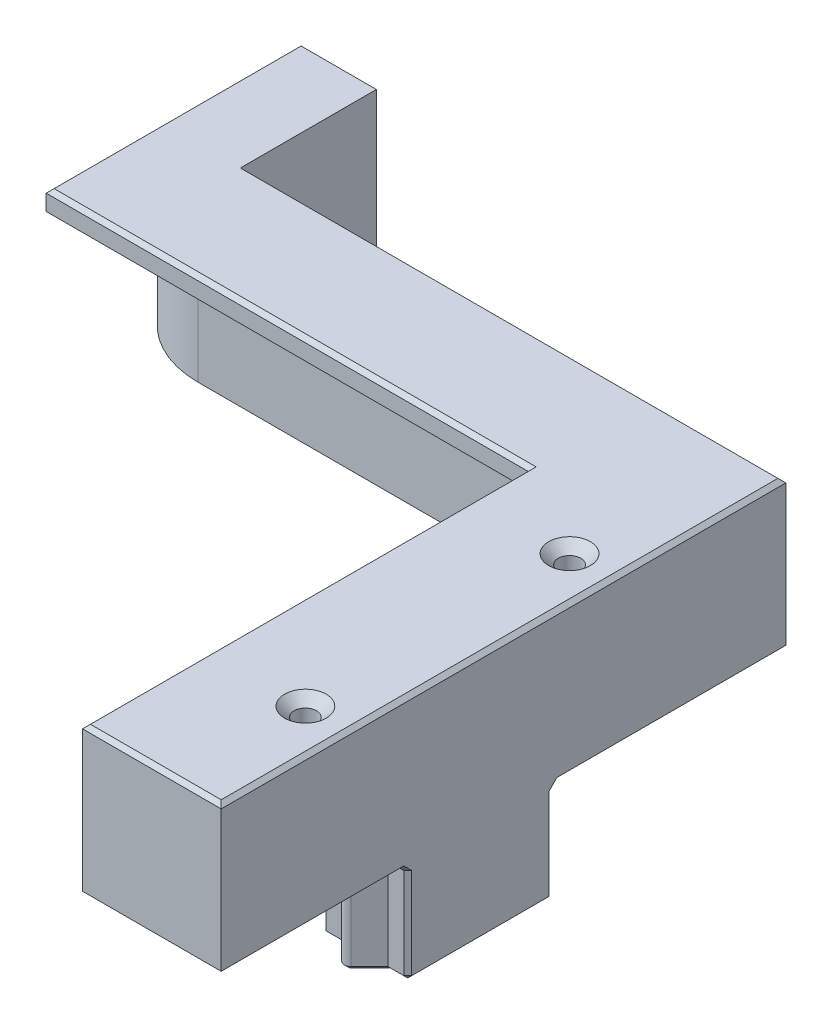
from build123d import *
from OCP.BRepFilletAPI import BRepFilletAPI_MakeFillet

# Parameters (mm, degrees)
BOSS_EXTRUDE1_DEPTH                                 = 15
BOSS_EXTRUDE2_DEPTH                                 = 22.5
SKETCH3_W                                           = 8
SKETCH3_H                                           = 3
BOSS_EXTRUDE3_DEPTH                                 = 3
SKETCH8_W                                           = 12
SKETCH8_H                                           = 25
CUT_EXTRUDE1_DEPTH                                  = 2
CSK_FOR_M3_COUNTERSUNK_FLAT_HEAD_SCREW1_D           = 3.4
CSK_FOR_M3_COUNTERSUNK_FLAT_HEAD_SCREW1_CSINK_D     = 6.3
CSK_FOR_M3_COUNTERSUNK_FLAT_HEAD_SCREW1_CSINK_ANGLE = 90
SKETCH9_W                                           = 12
SKETCH9_H                                           = 22.5
BOSS_EXTRUDE4_DEPTH                                 = 20
FILLET1_R                                           = 15
FILLET2_R1                                          = 1
FILLET2_R2                                          = 2
CHAMFER1_SIZE                                       = 0.6
CHAMFER2_SIZE                                       = 2


with BuildPart() as part:
    # Sketch1 → Boss-Extrude1 (new body)
    with BuildSketch(Plane(origin=(0, 0, 0), x_dir=(1, 0, 0), z_dir=(0, 1, 0))):
        Polygon((6.5, 14.5), (3, 11), (0, 11), (0, -11), (3, -11), (6.5, -14.5), (10, -11), (13, -11), (13, 11), (10, 11), align=None)
    extrude(amount=-BOSS_EXTRUDE1_DEPTH)

    # Sketch2 → Boss-Extrude2 (add)
    with BuildSketch(Plane(origin=(0, 0, 0), x_dir=(1, 0, 0), z_dir=(0, 1, 0))):
        Polygon((0, -39.25), (13, -39.25), (13, -11), (10, -11), (6.5, -14.5), (3, -11), (0, -11), align=None)
        Polygon((10, 11), (13, 11), (13, 46.25), (-81, 46.25), (-81, 36.25), (0, 36.25), (0, 11), (3, 11), (6.5, 14.5), align=None)
        Polygon((3, 11), (0, 11), (0, -11), (3, -11), (6.5, -14.5), (10, -11), (13, -11), (13, 11), (10, 11), (6.5, 14.5), align=None)
    extrude(amount=BOSS_EXTRUDE2_DEPTH)

    # Sweep1: sweep along a curve in space
    with BuildLine() as sweep1_path:
        Line((0, 22.5, 39.25), (0, 0, 39.25))
    # Sketch3 → Sweep1 (sweep)
    with BuildSketch(Plane(origin=(0, 22.5, 0), x_dir=(1, 0, 0), z_dir=(0, 1, 0))):
        with Locations((-4, -37.75)):
            Rectangle(SKETCH3_W, SKETCH3_H)
    sweep(path=sweep1_path.line)

    # Sketch4 → Boss-Extrude3 (add)
    with BuildSketch(Plane(origin=(0, 22.5, 0), x_dir=(1, 0, 0), z_dir=(0, 1, 0))):
        Polygon((-8, -36.25), (0, -36.25), (0, 36.25), (-81, 36.25), (-81, 28.25), (-8, 28.25), align=None)
    extrude(amount=-BOSS_EXTRUDE3_DEPTH)

    # Sketch8 → Cut-Extrude1 (cut)
    with BuildSketch(Plane.ZY):
        with Locations((0, 7)):
            Rectangle(SKETCH8_W, SKETCH8_H)
    extrude(amount=-CUT_EXTRUDE1_DEPTH, mode=Mode.SUBTRACT)

    # CSK for M3 Countersunk Flat Head Screw1 (through all)
    with Locations(Plane(origin=(0, 22.5, 0), x_dir=(1, 0, 0), z_dir=(0, 1, 0))):
        with Locations((6.5, 20), (6.5, -20)):
            CounterSinkHole(CSK_FOR_M3_COUNTERSUNK_FLAT_HEAD_SCREW1_D / 2, CSK_FOR_M3_COUNTERSUNK_FLAT_HEAD_SCREW1_CSINK_D / 2, counter_sink_angle=CSK_FOR_M3_COUNTERSUNK_FLAT_HEAD_SCREW1_CSINK_ANGLE)

    # Sketch9 → Boss-Extrude4 (add)
    with BuildSketch(Plane(origin=(0, 0, -46.25), x_dir=(-1, 0, 0), z_dir=(0, 0, -1))):
        with Locations((75, 11.25)):
            Rectangle(SKETCH9_W, SKETCH9_H)
    extrude(amount=BOSS_EXTRUDE4_DEPTH)

    # Fillet1
    fillet1_edges = [part.edges().sort_by_distance(p)[0] for p in [
        (-81, 9.75, -36.25),
    ]]
    fillet(fillet1_edges, radius=FILLET1_R)

    # Fillet2: one fillet with a radius per group of edges: ONE call of the kernel's fillet builder (fillet() takes one radius for all edges)
    fillet2_edges_1 = [part.edges().sort_by_distance(p)[0] for p in [
        (6.5, -7.5, -14.5),
        (6.5, -7.5, 14.5),
    ]]
    fillet2_edges_2 = [part.edges().sort_by_distance(p)[0] for p in [
        (0, 9.75, -36.25),
    ]]
    fillet2 = BRepFilletAPI_MakeFillet(part.part.solid().wrapped)
    for e in fillet2_edges_1:
        fillet2.Add(FILLET2_R1, e.wrapped)
    for e in fillet2_edges_2:
        fillet2.Add(FILLET2_R2, e.wrapped)
    add(Compound.cast(fillet2.Shape()), mode=Mode.REPLACE)

    # Chamfer1
    chamfer1_edges = [part.edges().sort_by_distance(p)[0] for p in [
        (1.5, 0, -11),
        (8.2, 0, -20),
        (8.603553391, 0, -12.396446609),
        (8.2, 0, 20),
        (11.5, 0, -11),
        (-69, 0, -56.25),
        (-75, 0, -66.25),
        (11.5, 0, 11),
        (4.396446609, -15, 12.396446609),
        (4.396446609, 0, 12.396446609),
        (-76.606601718, 0, -40.643398282),
        (1.5, 0, 11),
        (-34, 0, -36.25),
        (4.396446609, 0, -12.396446609),
        (4.396446609, -15, -12.396446609),
        (8.603553391, -15, 12.396446609),
        (6.5, -15, 14.085786438),
        (6.5, -15, -14.085786438),
        (8.603553391, 0, 12.396446609),
        (-0.585786438, 0, -35.664213562),
        (6.5, 0, -14.085786438),
        (6.5, 0, 14.085786438),
        (0, -7.5, -11),
        (13, -7.5, -11),
        (13, -7.5, 11),
        (0, -7.5, 11),
        (11.5, -15, 11),
        (13, -15, 0),
        (11.5, -15, -11),
        (2.5, 0, 39.25),
        (8.603553391, -15, -12.396446609),
        (0, 0, -22.625),
        (2.5, 22.5, 39.25),
        (13, 0, 25.125),
        (13, 0, -28.625),
        (-28, 0, -46.25),
        (-81, 0, -58.75),
        (13, 22.5, -3.5),
        (-28, 22.5, -46.25),
        (-81, 22.5, -47.25),
        (1.5, -15, -11),
        (0, -15, 0),
        (0, 0, 23.625),
        (-8, 22.5, 5.5),
        (-4, 0, 36.25),
        (-8, 0, 37.75),
        (-44.5, 22.5, -28.25),
        (1.5, -15, 11),
    ]]
    chamfer(chamfer1_edges, length=CHAMFER1_SIZE)

    # Chamfer2
    chamfer2_edges = [part.edges().sort_by_distance(p)[0] for p in [
        (2, -5.5, 0),
    ]]
    chamfer(chamfer2_edges, length=CHAMFER2_SIZE - 0.0001)  # a hair under: the kernel refuses the full size


solid = part.part
